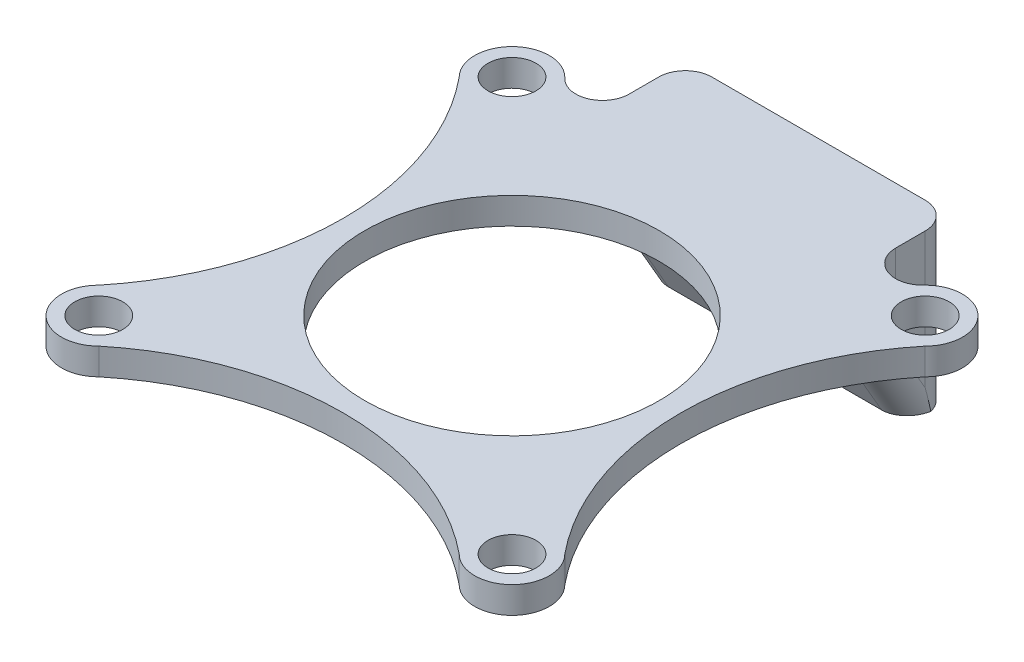
from build123d import *

# Parameters (mm, degrees)
SKETCH_1_R          = 1.8
EXTRUDE_1_DEPTH     = 2
EXTRUDE_START       = 10
EXTRUDE_2_DEPTH     = 10
SKETCH_3_R          = 0.75
CUT_EXTRUDE_1_DEPTH = 10
FILLET_3_R          = 2
CHAMFER_1_SIZE      = 5.773502692
CHAMFER_1_SIZE_2    = 10
FILLET_1_R          = 2
FILLET_2_R          = 2


with BuildPart() as part:
    # 草图1 → 凸台-拉伸1 (new body)
    # profile 1 of 19: a face of its own
    with BuildSketch(Plane(origin=(0, 0, 0), x_dir=(1, 0, 0), z_dir=(0, 1, 0))):
        with BuildLine():
            ThreePointArc((17.479898987, 13.520101013), (17.479898987, 17.479898987), (13.520101013, 17.479898987))
            Line((13.520101013, 17.479898987), (10, 13.959797975))
            Line((10, 13.959797975), (6.743130876, 10.702928851))
            ThreePointArc((6.743130876, 10.702928851), (8.944900782, 8.944900782), (10.702928851, 6.743130876))
            Line((10.702928851, 6.743130876), (17.479898987, 13.520101013))
        make_face()
        with Locations(Location((15.5, 15.5, 0), (0, 0, 270))):
            Circle(SKETCH_1_R, mode=Mode.SUBTRACT)
    # profile 2 of 19: a face of its own
    with BuildSketch(Plane(origin=(0, 0, 0), x_dir=(1, 0, 0), z_dir=(0, 1, 0))):
        with BuildLine():
            ThreePointArc((10.702928851, 6.743130876), (8.944900782, 8.944900782), (6.743130876, 10.702928851))
            Line((6.743130876, 10.702928851), (5.578622694, 9.538420668))
            ThreePointArc((5.578622694, 9.538420668), (7.813529932, 7.813529932), (9.538420668, 5.578622694))
            Line((9.538420668, 5.578622694), (10.702928851, 6.743130876))
        make_face()
    # profile 3 of 19: a face of its own
    with BuildSketch(Plane(origin=(0, 0, 0), x_dir=(1, 0, 0), z_dir=(0, 1, 0))):
        with BuildLine():
            Line((5.578622694, 9.538420668), (6.743130876, 10.702928851))
            ThreePointArc((6.743130876, 10.702928851), (0, 12.65), (-6.743130876, 10.702928851))
            Line((-6.743130876, 10.702928851), (-5.578622694, 9.538420668))
            ThreePointArc((-5.578622694, 9.538420668), (0, 11.05), (5.578622694, 9.538420668))
        make_face()
    # profile 4 of 19: a face of its own
    with BuildSketch(Plane(origin=(0, 0, 0), x_dir=(1, 0, 0), z_dir=(0, 1, 0))):
        with BuildLine():
            ThreePointArc((12.65, 0), (12.153488182, 3.509305489), (10.702928851, 6.743130876))
            Line((10.702928851, 6.743130876), (9.538420668, 5.578622694))
            ThreePointArc((9.538420668, 5.578622694), (10.665412519, 2.889892006), (11.05, 0))
            ThreePointArc((11.05, 0), (10.665412519, -2.889892006), (9.538420668, -5.578622694))
            Line((9.538420668, -5.578622694), (10.702928851, -6.743130876))
            ThreePointArc((10.702928851, -6.743130876), (12.153488182, -3.509305489), (12.65, 0))
        make_face()
    # profile 5 of 19: a face of its own
    with BuildSketch(Plane(origin=(0, 0, 0), x_dir=(1, 0, 0), z_dir=(0, 1, 0))):
        with BuildLine():
            ThreePointArc((6.743130876, -10.702928851), (8.944900782, -8.944900782), (10.702928851, -6.743130876))
            Line((10.702928851, -6.743130876), (9.538420668, -5.578622694))
            ThreePointArc((9.538420668, -5.578622694), (7.813529932, -7.813529932), (5.578622694, -9.538420668))
            Line((5.578622694, -9.538420668), (6.743130876, -10.702928851))
        make_face()
    # profile 6 of 19: a face of its own
    with BuildSketch(Plane(origin=(0, 0, 0), x_dir=(1, 0, 0), z_dir=(0, 1, 0))):
        with BuildLine():
            ThreePointArc((0, -12.65), (3.50930549, -12.153488182), (6.743130876, -10.702928851))
            Line((6.743130876, -10.702928851), (5.578622694, -9.538420668))
            ThreePointArc((5.578622694, -9.538420668), (0, -11.05), (-5.578622694, -9.538420668))
            Line((-5.578622694, -9.538420668), (-6.743130876, -10.702928851))
            ThreePointArc((-6.743130876, -10.702928851), (-3.509305489, -12.153488182), (0, -12.65))
        make_face()
    # profile 7 of 19: a face of its own
    with BuildSketch(Plane(origin=(0, 0, 0), x_dir=(1, 0, 0), z_dir=(0, 1, 0))):
        with BuildLine():
            Line((17.479898987, -13.520101013), (10.702928851, -6.743130876))
            ThreePointArc((10.702928851, -6.743130876), (8.944900782, -8.944900782), (6.743130876, -10.702928851))
            Line((6.743130876, -10.702928851), (13.520101013, -17.479898987))
            ThreePointArc((13.520101013, -17.479898987), (17.479898987, -17.479898987), (17.479898987, -13.520101013))
        make_face()
        with Locations(Location((15.5, -15.5, 0), (0, 0, 270))):
            Circle(SKETCH_1_R, mode=Mode.SUBTRACT)
    # profile 8 of 19: a face of its own
    with BuildSketch(Plane(origin=(0, 0, 0), x_dir=(1, 0, 0), z_dir=(0, 1, 0))):
        with BuildLine():
            ThreePointArc((-6.743130876, -10.702928851), (-8.944900782, -8.944900782), (-10.702928851, -6.743130876))
            Line((-10.702928851, -6.743130876), (-17.479898987, -13.520101013))
            ThreePointArc((-17.479898987, -13.520101013), (-17.479898987, -17.479898987), (-13.520101013, -17.479898987))
            Line((-13.520101013, -17.479898987), (-6.743130876, -10.702928851))
        make_face()
        with Locations(Location((-15.5, -15.5, 0), (0, 0, 270))):
            Circle(SKETCH_1_R, mode=Mode.SUBTRACT)
    # profile 9 of 19: a face of its own
    with BuildSketch(Plane(origin=(0, 0, 0), x_dir=(1, 0, 0), z_dir=(0, 1, 0))):
        with BuildLine():
            Line((13.520101013, -17.479898987), (6.743130876, -10.702928851))
            ThreePointArc((6.743130876, -10.702928851), (3.50930549, -12.153488182), (0, -12.65))
            ThreePointArc((0, -12.65), (7.178458324, -13.893720868), (13.520101013, -17.479898987))
        make_face()
    # profile 10 of 19: a face of its own
    with BuildSketch(Plane(origin=(0, 0, 0), x_dir=(1, 0, 0), z_dir=(0, 1, 0))):
        with BuildLine():
            ThreePointArc((-13.520101013, -17.479898987), (-7.178458324, -13.893720867), (0, -12.65))
            ThreePointArc((0, -12.65), (-3.509305489, -12.153488182), (-6.743130876, -10.702928851))
            Line((-6.743130876, -10.702928851), (-13.520101013, -17.479898987))
        make_face()
    # profile 11 of 19: a face of its own
    with BuildSketch(Plane(origin=(0, 0, 0), x_dir=(1, 0, 0), z_dir=(0, 1, 0))):
        with BuildLine():
            ThreePointArc((17.479898987, -13.520101013), (13.893720868, -7.178458324), (12.65, 0))
            ThreePointArc((12.65, 0), (12.153488182, -3.509305489), (10.702928851, -6.743130876))
            Line((10.702928851, -6.743130876), (17.479898987, -13.520101013))
        make_face()
    # profile 12 of 19: a face of its own
    with BuildSketch(Plane(origin=(0, 0, 0), x_dir=(1, 0, 0), z_dir=(0, 1, 0))):
        with BuildLine():
            ThreePointArc((12.65, 0), (13.893720868, 7.178458324), (17.479898987, 13.520101013))
            Line((17.479898987, 13.520101013), (10.702928851, 6.743130876))
            ThreePointArc((10.702928851, 6.743130876), (12.153488182, 3.509305489), (12.65, 0))
        make_face()
    # profile 13 of 19: a face of its own
    with BuildSketch(Plane(origin=(0, 0, 0), x_dir=(1, 0, 0), z_dir=(0, 1, 0))):
        with BuildLine():
            ThreePointArc((-12.65, 2.4e-08), (-12.153488178, 3.509305501), (-10.702928851, 6.743130876))
            Line((-10.702928851, 6.743130876), (-17.479898987, 13.520101013))
            ThreePointArc((-17.479898987, 13.520101013), (-13.893720872, 7.178458335), (-12.65, 2.4e-08))
        make_face()
    # profile 14 of 19: a face of its own
    with BuildSketch(Plane(origin=(0, 0, 0), x_dir=(1, 0, 0), z_dir=(0, 1, 0))):
        with BuildLine():
            ThreePointArc((-10.702928851, -6.743130876), (-12.153488185, -3.509305478), (-12.65, 2.4e-08))
            ThreePointArc((-12.65, 2.4e-08), (-13.893720864, -7.178458313), (-17.479898987, -13.520101013))
            Line((-17.479898987, -13.520101013), (-10.702928851, -6.743130876))
        make_face()
    # profile 15 of 19: a face of its own
    with BuildSketch(Plane(origin=(0, 0, 0), x_dir=(1, 0, 0), z_dir=(0, 1, 0))):
        with BuildLine():
            ThreePointArc((-10.702928851, 6.743130876), (-8.944900782, 8.944900782), (-6.743130876, 10.702928851))
            Line((-6.743130876, 10.702928851), (-10, 13.959797975))
            Line((-10, 13.959797975), (-13.520101013, 17.479898987))
            ThreePointArc((-13.520101013, 17.479898987), (-17.479898987, 17.479898987), (-17.479898987, 13.520101013))
            Line((-17.479898987, 13.520101013), (-10.702928851, 6.743130876))
        make_face()
        with Locations(Location((-15.5, 15.5, 0), (0, 0, 270))):
            Circle(SKETCH_1_R, mode=Mode.SUBTRACT)
    # profile 16 of 19: a face of its own
    with BuildSketch(Plane(origin=(0, 0, 0), x_dir=(1, 0, 0), z_dir=(0, 1, 0))):
        with BuildLine():
            Line((-5.578622694, 9.538420668), (-6.743130876, 10.702928851))
            ThreePointArc((-6.743130876, 10.702928851), (-8.944900782, 8.944900782), (-10.702928851, 6.743130876))
            Line((-10.702928851, 6.743130876), (-9.538420668, 5.578622694))
            ThreePointArc((-9.538420668, 5.578622694), (-7.813529932, 7.813529932), (-5.578622694, 9.538420668))
        make_face()
    # profile 17 of 19: a face of its own
    with BuildSketch(Plane(origin=(0, 0, 0), x_dir=(1, 0, 0), z_dir=(0, 1, 0))):
        with BuildLine():
            Line((-9.538420668, 5.578622694), (-10.702928851, 6.743130876))
            ThreePointArc((-10.702928851, 6.743130876), (-12.153488178, 3.509305501), (-12.65, 2.4e-08))
            ThreePointArc((-12.65, 2.4e-08), (-12.153488185, -3.509305478), (-10.702928851, -6.743130876))
            Line((-10.702928851, -6.743130876), (-9.538420668, -5.578622694))
            ThreePointArc((-9.538420668, -5.578622694), (-11.05, 0), (-9.538420668, 5.578622694))
        make_face()
    # profile 18 of 19: a face of its own
    with BuildSketch(Plane(origin=(0, 0, 0), x_dir=(1, 0, 0), z_dir=(0, 1, 0))):
        with BuildLine():
            ThreePointArc((-5.578622694, -9.538420668), (-7.813529932, -7.813529932), (-9.538420668, -5.578622694))
            Line((-9.538420668, -5.578622694), (-10.702928851, -6.743130876))
            ThreePointArc((-10.702928851, -6.743130876), (-8.944900782, -8.944900782), (-6.743130876, -10.702928851))
            Line((-6.743130876, -10.702928851), (-5.578622694, -9.538420668))
        make_face()
    # profile 19 of 19: a face of its own
    with BuildSketch(Plane(origin=(0, 0, 0), x_dir=(1, 0, 0), z_dir=(0, 1, 0))):
        with BuildLine():
            Line((6.743130876, 10.702928851), (10, 13.959797975))
            Line((10, 13.959797975), (10, 21))
            ThreePointArc((10, 21), (9.414213562, 22.414213562), (8, 23))
            Line((8, 23), (-8, 23))
            ThreePointArc((-8, 23), (-9.414213562, 22.414213562), (-10, 21))
            Line((-10, 21), (-10, 13.959797975))
            Line((-10, 13.959797975), (-6.743130876, 10.702928851))
            ThreePointArc((-6.743130876, 10.702928851), (0, 12.65), (6.743130876, 10.702928851))
        make_face()
    extrude(amount=EXTRUDE_1_DEPTH)

    # 草图2 → 凸台-拉伸2 (add)
    with BuildSketch(Plane.XZ.offset(EXTRUDE_START)):
        with BuildLine():
            Line((10, -13.959797975), (-10, -13.959797975))
            Line((-10, -13.959797975), (-10, -21))
            ThreePointArc((-10, -21), (-9.414213562, -22.414213562), (-8, -23))
            Line((-8, -23), (8, -23))
            ThreePointArc((8, -23), (9.414213562, -22.414213562), (10, -21))
            Line((10, -21), (10, -13.959797975))
        make_face()
    extrude(amount=-EXTRUDE_2_DEPTH)

    # 草图3 → 切除-拉伸1 (cut)
    with BuildSketch(Plane(origin=(0, 0, -23), x_dir=(-1, 0, 0), z_dir=(0, 0, -1))):
        with Locations((4.75, -5)):
            Circle(SKETCH_3_R)
        with Locations((-4.75, -5)):
            Circle(SKETCH_3_R)
    extrude(amount=-CUT_EXTRUDE_1_DEPTH, mode=Mode.SUBTRACT)

    # 圆角3
    fillet_3_edges = [part.edges().sort_by_distance(p)[0] for p in [
        (-10, 1, -13.959797975),
        (10, 1, -13.959797975),
    ]]
    fillet(fillet_3_edges, radius=FILLET_3_R)

    # 倒角1
    # the kernel refuses this chamfer: 10, 5.773502692 mm, written as the material it takes off along each edge
    with BuildSketch(Plane(origin=(35.870857546, -10, -13.959797975), x_dir=(0, 0, -1), z_dir=(-1, 0, 0))) as chamfer_1_piece_1_section:
        Polygon((CHAMFER_1_SIZE, 0), (0, -CHAMFER_1_SIZE_2), (0, 0), align=None)
    chamfer_1_piece_1 = extrude(amount=71.741715093, mode=Mode.PRIVATE)
    chamfer_1_piece_1 = split(chamfer_1_piece_1, bisect_by=Plane(origin=(35.870857546, 0, -13.959797975), z_dir=(0, -1, 0)), keep=Keep.TOP, mode=Mode.PRIVATE)
    add(chamfer_1_piece_1, mode=Mode.SUBTRACT)

    # 圆角1
    fillet_1_edges = [part.edges().sort_by_distance(p)[0] for p in [
        (0, 0, -13.959797975),
    ]]
    fillet(fillet_1_edges, radius=FILLET_1_R)

    # 圆角2
    # the kernel refuses this fillet: 2 mm, written as the material it takes off along each edge
    with BuildSketch(Plane(origin=(-10, -2, -12.805097436), x_dir=(0, -0.8014106175284074, 0.5981145560114189), z_dir=(0, -0.5981145560114189, -0.8014106175284074))) as fillet_2_piece_1_section:
        with BuildLine():
            CenterArc((2 + FILLET_2_R, -FILLET_2_R), FILLET_2_R, 90, 90)
            Line((2, -FILLET_2_R), (2, 0))
            Line((2, 0), (2 + FILLET_2_R, 0))
        make_face()
    fillet_2_piece_1 = revolve(axis=Axis((-10, -2, -12.805097436), (-1, 0, 0)), revolution_arc=203.265018323, mode=Mode.PRIVATE)
    fillet_2_piece_1 = split(fillet_2_piece_1, bisect_by=Plane(origin=(-10, 0, -12.805097436), z_dir=(0, -1, 0)), keep=Keep.TOP, mode=Mode.PRIVATE)
    add(fillet_2_piece_1, mode=Mode.SUBTRACT)
    with BuildSketch(Plane(origin=(10, -2, -12.805097436), x_dir=(0, -0.8014106175284074, 0.5981145560114189), z_dir=(0, -0.5981145560114189, -0.8014106175284074))) as fillet_2_piece_2_section:
        with BuildLine():
            CenterArc((2 + FILLET_2_R, FILLET_2_R), FILLET_2_R, 180, 90)
            Line((2 + FILLET_2_R, 0), (2, 0))
            Line((2, 0), (2, FILLET_2_R))
        make_face()
    fillet_2_piece_2 = revolve(axis=Axis((10, -2, -12.805097436), (-1, 0, 0)), revolution_arc=203.265018323, mode=Mode.PRIVATE)
    fillet_2_piece_2 = split(fillet_2_piece_2, bisect_by=Plane(origin=(10, 0, -12.805097436), z_dir=(0, -1, 0)), keep=Keep.TOP, mode=Mode.PRIVATE)
    add(fillet_2_piece_2, mode=Mode.SUBTRACT)
    with BuildSketch(Plane(origin=(-10, -14.330127019, -22.233300667), x_dir=(1, 0, 0), z_dir=(0, 0.8660254037805484, 0.5000000000067383)), Plane(origin=(10, -1, -14.537148244), x_dir=(-1, 0, 0), z_dir=(0, -0.8660254037805484, -0.5000000000067383))) as fillet_2_piece_3:
        with BuildLine():
            CenterArc((FILLET_2_R, FILLET_2_R), FILLET_2_R, 180, 90)
            Line((0, FILLET_2_R), (0, 0))
            Line((0, 0), (FILLET_2_R, 0))
        make_face()
    extrude(amount=15.392304845, mode=Mode.SUBTRACT)


solid = part.part
